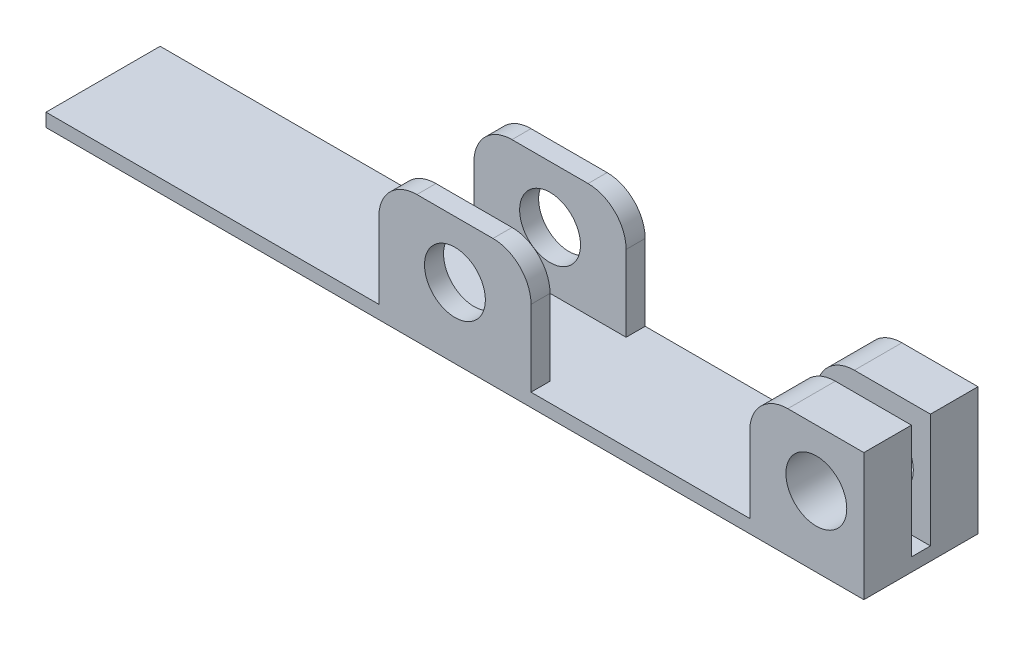
from build123d import *

# Parameters (mm, degrees)
SKETCH2_W           = 215
SKETCH2_H           = 30
BOSS_EXTRUDE1_DEPTH = 3.5
SKETCH4_W           = 30
SKETCH4_H           = 12.5
SKETCH4_W_2         = 40
SKETCH4_H_2         = 5
BOSS_EXTRUDE2_DEPTH = 30
SKETCH5_R           = 8
BEARING_HOLES_DEPTH = 117.526820947
FILLET1_R           = 10


with BuildPart() as part:
    # Sketch2 → Boss-Extrude1 (new body)
    with BuildSketch(Plane(origin=(0, 0, 0), x_dir=(1, 0, 0), z_dir=(0, 1, 0))):
        Rectangle(SKETCH2_W, SKETCH2_H)
    extrude(amount=BOSS_EXTRUDE1_DEPTH)

    # Sketch4 → Boss-Extrude2 (add)
    with BuildSketch(Plane(origin=(0, 3.5, 0), x_dir=(1, 0, 0), z_dir=(0, 1, 0))):
        with Locations((92.5, -8.75)):
            Rectangle(SKETCH4_W, SKETCH4_H)
        with Locations((0, -12.5)):
            Rectangle(SKETCH4_W_2, SKETCH4_H_2)
        with Locations((0, 12.5)):
            Rectangle(SKETCH4_W_2, SKETCH4_H_2)
        with Locations((92.5, 8.75)):
            Rectangle(SKETCH4_W, SKETCH4_H)
    extrude(amount=BOSS_EXTRUDE2_DEPTH)

    # Sketch5 → Bearing holes (cut, through all)
    with BuildSketch(Plane.XY.offset(15)):
        with Locations((0, 18.5)):
            Circle(SKETCH5_R)
        with Locations((95, 18.5)):
            Circle(SKETCH5_R)
    extrude(amount=-BEARING_HOLES_DEPTH, mode=Mode.SUBTRACT)

    # Fillet1
    fillet1_edges = [part.edges().sort_by_distance(p)[0] for p in [
        (-20, 33.5, 12.5),
        (-20, 33.5, -12.5),
        (20, 33.5, -12.5),
        (20, 33.5, 12.5),
        (77.5, 33.5, 8.75),
        (77.5, 33.5, -8.75),
    ]]
    fillet(fillet1_edges, radius=FILLET1_R)


solid = part.part
